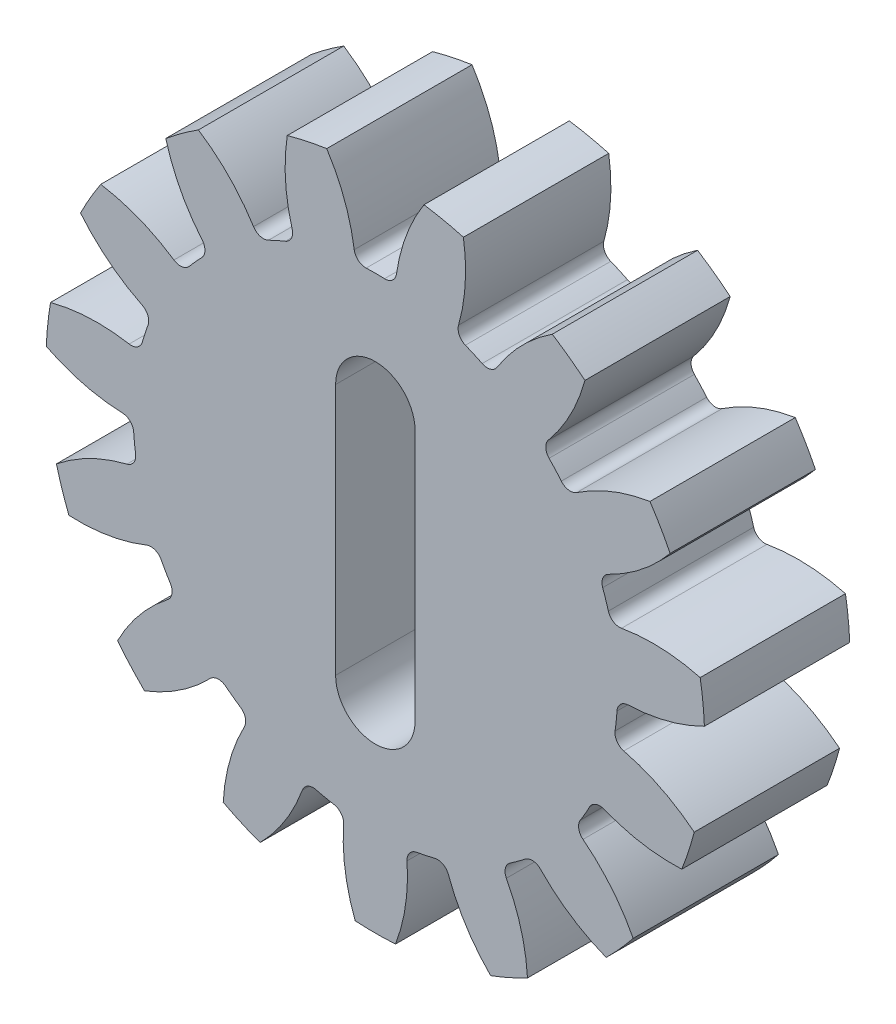
from build123d import *

# Parameters (mm, degrees)
SKBASE_R                                = 17
BASE_DEPTH                              = 3.75
TOOTHPROFILE_DEPTH                      = 25.332334454
FILLETTOOTHPROFILE_R                    = 0.6
CIRPATTERNTEETH_COUNT                   = 15
FILLETTOOTHPROFILE_OF_CIRPATTERNTEETH_R = 0.6
CUT_EXTRUDE1_DEPTH                      = 26.173492407


with BuildPart() as part:
    # skBase → Base (new, symmetric)
    with BuildSketch(Plane.XY):
        Circle(SKBASE_R)
    extrude(amount=BASE_DEPTH, both=True)

    # skToothProfile → ToothProfile (cut, symmetric)
    with BuildSketch(Plane.XY):
        with BuildLine():
            ThreePointArc((-1.028787688, 12.457591898), (-1.696916539, 15.252383315), (-3.172291449, 17.71825519))
            ThreePointArc((-3.172291449, 17.71825519), (0, 18), (3.172291449, 17.71825519))
            ThreePointArc((3.172291449, 17.71825519), (1.696916539, 15.252383315), (1.028787688, 12.457591898))
            ThreePointArc((1.028787688, 12.457591898), (0, 12.5), (-1.028787688, 12.457591898))
        make_face()
    toothprofile = extrude(amount=TOOTHPROFILE_DEPTH, both=True, mode=Mode.SUBTRACT)

    # FilletToothProfile
    fillettoothprofile_edges = [part.edges().sort_by_distance(p)[0] for p in [
        (1.028787688, 12.457591898, 0),
        (-1.028787688, 12.457591898, 0),
    ]]
    fillet(fillettoothprofile_edges, radius=FILLETTOOTHPROFILE_R)

    # CirPatternTeeth: ToothProfile ×15 about axis
    cirpatternteeth_axis = Axis((0, 0, 3.75), (0, 0, 1))
    for i in range(1, CIRPATTERNTEETH_COUNT):
        add(toothprofile.rotate(cirpatternteeth_axis, i * 360 / CIRPATTERNTEETH_COUNT), mode=Mode.SUBTRACT)

    # FilletToothProfile of CirPatternTeeth
    fillettoothprofile_of_cirpatternteeth_edges = [part.edges().sort_by_distance(p)[0] for p in [
        (-4.12711479, 11.799022142, 0),
        (-6.006803429, 10.962130841, 0),
        (-8.569401627, 9.100294267, 0),
        (-9.946188286, 7.571217773, 0),
        (-11.529961073, 4.82804284, 0),
        (-12.165786831, 2.871172371, 0),
        (-12.496885502, -0.279021055, 0),
        (-12.28181031, -2.325324819, 0),
        (-11.302984898, -5.337839676, 0),
        (-10.274197209, -7.119752222, 0),
        (-8.15469552, -9.473697323, 0),
        (-6.490082073, -10.683109785, 0),
        (-3.596385204, -11.971466638, 0),
        (-1.583772786, -12.399260614, 0),
        (1.583772786, -12.399260614, 0),
        (3.596385204, -11.971466638, 0),
        (6.490082073, -10.683109785, 0),
        (8.15469552, -9.473697323, 0),
        (10.274197209, -7.119752222, 0),
        (11.302984898, -5.337839676, 0),
        (12.28181031, -2.325324819, 0),
        (12.496885502, -0.279021055, 0),
        (12.165786831, 2.871172371, 0),
        (11.529961073, 4.82804284, 0),
        (9.946188286, 7.571217773, 0),
        (8.569401627, 9.100294267, 0),
        (6.006803429, 10.962130841, 0),
        (4.12711479, 11.799022142, 0),
    ]]
    fillet(fillettoothprofile_of_cirpatternteeth_edges, radius=FILLETTOOTHPROFILE_OF_CIRPATTERNTEETH_R)

    # Sketch5 → Cut-Extrude1 (cut, through all)
    with BuildSketch(Plane(origin=(0, 0, -3.75), x_dir=(-1, 0, 0), z_dir=(0, 0, -1))):
        with BuildLine():
            Line((2.05, 6.5), (2.05, -6.5))
            ThreePointArc((2.05, -6.5), (0, -8.55), (-2.05, -6.5))
            Line((-2.05, -6.5), (-2.05, 6.5))
            ThreePointArc((-2.05, 6.5), (0, 8.55), (2.05, 6.5))
        make_face()
    extrude(amount=-CUT_EXTRUDE1_DEPTH, mode=Mode.SUBTRACT)


solid = part.part
